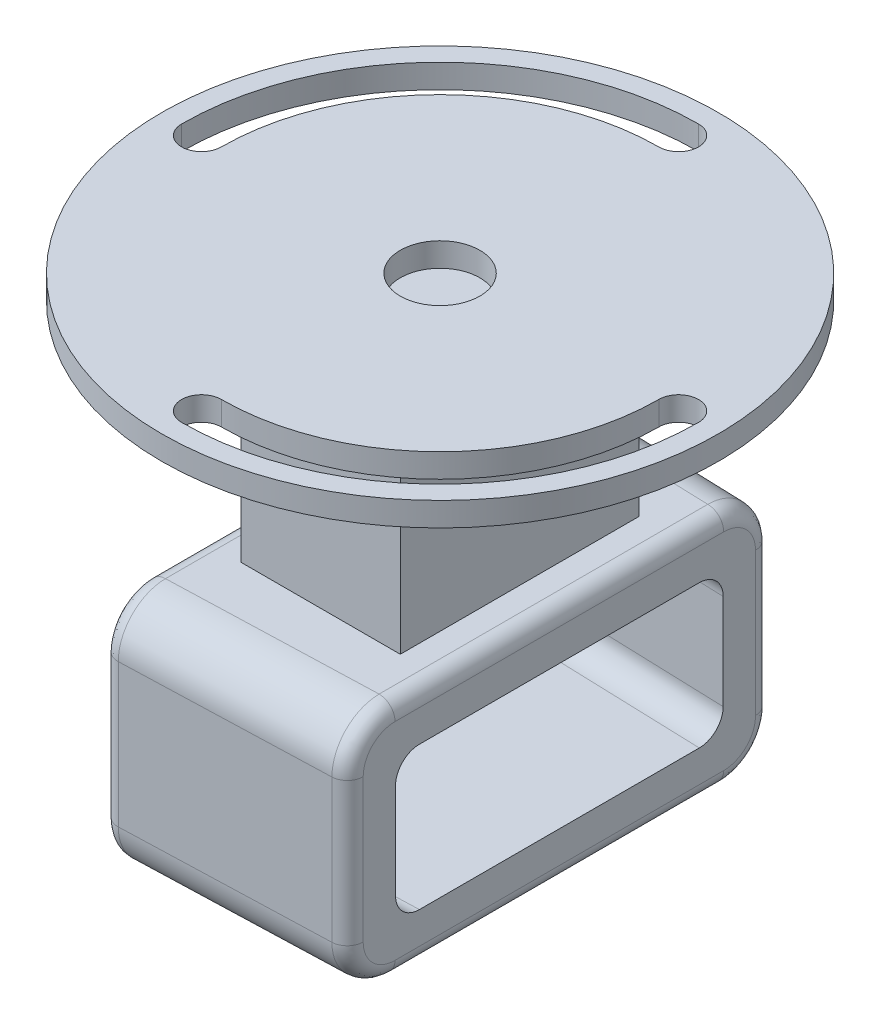
from build123d import *

# Parameters (mm, degrees)
SKETCH_1_R          = 35
SKETCH_1_R_2        = 5
EXTRUDE_1_DEPTH     = 3
SKETCH_2_W          = 20
SKETCH_2_H          = 30
EXTRUDE_2_DEPTH     = 26
EXTRUDE_4_DEPTH     = 6
EXTRUDE_5_DEPTH     = 30
EXTRUDE_START       = 30
EXTRUDE_6_DEPTH     = 6
FILLET_1_R          = 3
FILLET_2_R          = 6
FILLET_3_R          = 2
SKETCH_7_W          = 10
SKETCH_7_H          = 6
CUT_EXTRUDE_1_DEPTH = 6
FILLET_4_R          = 1


with BuildPart() as part:
    # 스케치1 → 보스-돌출1 (new body)
    with BuildSketch(Plane(origin=(0, 0, 0), x_dir=(1, 0, 0), z_dir=(0, 1, 0))):
        with Locations(Location((0, 0, 0), (0, 0, 270))):
            Circle(SKETCH_1_R)
        with Locations(Location((0, 0, 0), (0, 0, 270))):
            Circle(SKETCH_1_R_2, mode=Mode.SUBTRACT)
        with BuildLine():
            ThreePointArc((0, 27.5), (2.5, 30), (0, 32.5))
            ThreePointArc((0, 32.5), (-22.980970389, 22.980970389), (-32.5, 0))
            ThreePointArc((-32.5, 0), (-30, -2.5), (-27.5, 0))
            ThreePointArc((-27.5, 0), (-19.445436483, 19.445436483), (0, 27.5))
        make_face(mode=Mode.SUBTRACT)
        with BuildLine():
            ThreePointArc((32.5, 0), (30, 2.5), (27.5, 0))
            ThreePointArc((27.5, 0), (19.445436483, -19.445436483), (0, -27.5))
            ThreePointArc((0, -27.5), (-2.5, -30), (0, -32.5))
            ThreePointArc((0, -32.5), (22.980970389, -22.980970389), (32.5, 0))
        make_face(mode=Mode.SUBTRACT)
    extrude(amount=EXTRUDE_1_DEPTH)

    # 스케치2 → 보스-돌출2 (add)
    with BuildSketch(Plane.XZ):
        Rectangle(SKETCH_2_W, SKETCH_2_H)
    extrude(amount=EXTRUDE_2_DEPTH)

    # 스케치5 → 보스-돌출4 (add)
    with BuildSketch(Plane.XZ.offset(26)):
        Polygon((15, 20.6), (15, -20.6), (-15, -21.6), (-15, 21.6), align=None)
    extrude(amount=EXTRUDE_4_DEPTH)

    # 스케치6 → 보스-돌출5 (add)
    with BuildSketch(Plane(origin=(0, -26, 0), x_dir=(1, 0, 0), z_dir=(0, 1, 0))):
        Polygon((-15, -21.6), (-15, -27.6), (15, -26.6), (15, -20.6), align=None)
        Polygon((-15, 21.6), (-15, 27.6), (15, 26.6), (15, 20.6), align=None)
    extrude(amount=-EXTRUDE_5_DEPTH)

    # 스케치5<2> → 보스-돌출6 (add)
    with BuildSketch(Plane.XZ.offset(26).offset(EXTRUDE_START)):
        Polygon((15, 20.6), (15, -20.6), (-15, -21.6), (-15, 21.6), align=None)
    extrude(amount=-EXTRUDE_6_DEPTH)

    # 필렛1
    fillet_1_edges = [part.edges().sort_by_distance(p)[0] for p in [
        (0, -32, 21.1),
        (0, -32, -21.1),
        (0, -50, -21.1),
        (0, -50, 21.1),
    ]]
    fillet(fillet_1_edges, radius=FILLET_1_R)

    # 필렛2
    fillet_2_edges = [part.edges().sort_by_distance(p)[0] for p in [
        (0, -56, 27.1),
        (0, -26, 27.1),
        (0, -56, -27.1),
        (0, -26, -27.1),
    ]]
    fillet(fillet_2_edges, radius=FILLET_2_R)

    # 필렛3
    fillet_3_edges = [part.edges().sort_by_distance(p)[0] for p in [
        (-15, -26, 0),
        (15, -26, 0),
        (15, -41, 26.6),
        (15, -56, 0),
        (15, -41, -26.6),
        (15, -54.243229575, 24.841075351),
        (15, -54.243229575, -24.841075351),
        (15, -27.756770425, -24.841075351),
        (15, -27.756770425, 24.841075351),
        (-15, -41, 27.6),
        (-15, -41, -27.6),
        (-15, -56, 0),
        (-15, -54.243229575, 25.841075351),
        (-15, -54.243229575, -25.841075351),
        (-15, -27.756770425, -25.841075351),
        (-15, -27.756770425, 25.841075351),
    ]]
    fillet(fillet_3_edges, radius=FILLET_3_R)

    # 스케치7 → 컷-돌출1 (cut)
    with BuildSketch(Plane(origin=(0, -56, 0), x_dir=(-1, 0, 0), z_dir=(0, -1, 0))):
        with Locations((10, 12.6)):
            Rectangle(SKETCH_7_W, SKETCH_7_H)
    extrude(amount=-CUT_EXTRUDE_1_DEPTH, mode=Mode.SUBTRACT)

    # 필렛4
    fillet_4_edges = [part.edges().sort_by_distance(p)[0] for p in [
        (-14.414213562, -55.414213562, -15.6),
        (-14.414213562, -55.414213562, -9.6),
        (-15, -52, -15.6),
        (-10, -50, -9.6),
        (-15, -52, -9.6),
        (-5, -50, -12.6),
        (-10, -50, -15.6),
        (-9, -56, -9.6),
        (-9, -56, -15.6),
        (-5, -56, -12.6),
    ]]
    fillet(fillet_4_edges, radius=FILLET_4_R)


solid = part.part
